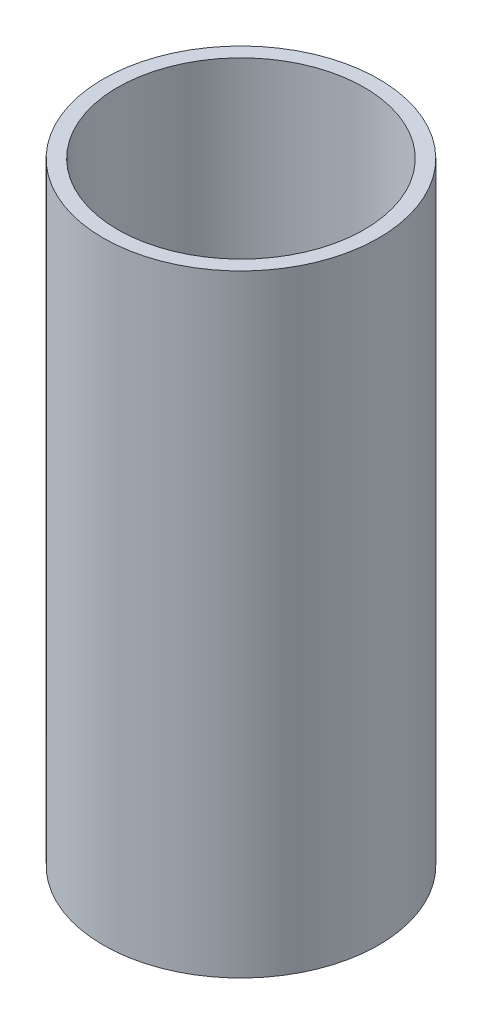
from build123d import *

# Parameters (mm, degrees)
SKETCH1_R           = 57.15
SKETCH1_R_2         = 51.1302
BOSS_EXTRUDE1_DEPTH = 254


with BuildPart() as part:
    # Sketch1 → Boss-Extrude1 (new body)
    with BuildSketch(Plane(origin=(0, 0, 0), x_dir=(1, 0, 0), z_dir=(0, 1, 0))):
        Circle(SKETCH1_R)
        Circle(SKETCH1_R_2, mode=Mode.SUBTRACT)
    extrude(amount=BOSS_EXTRUDE1_DEPTH)


solid = part.part
